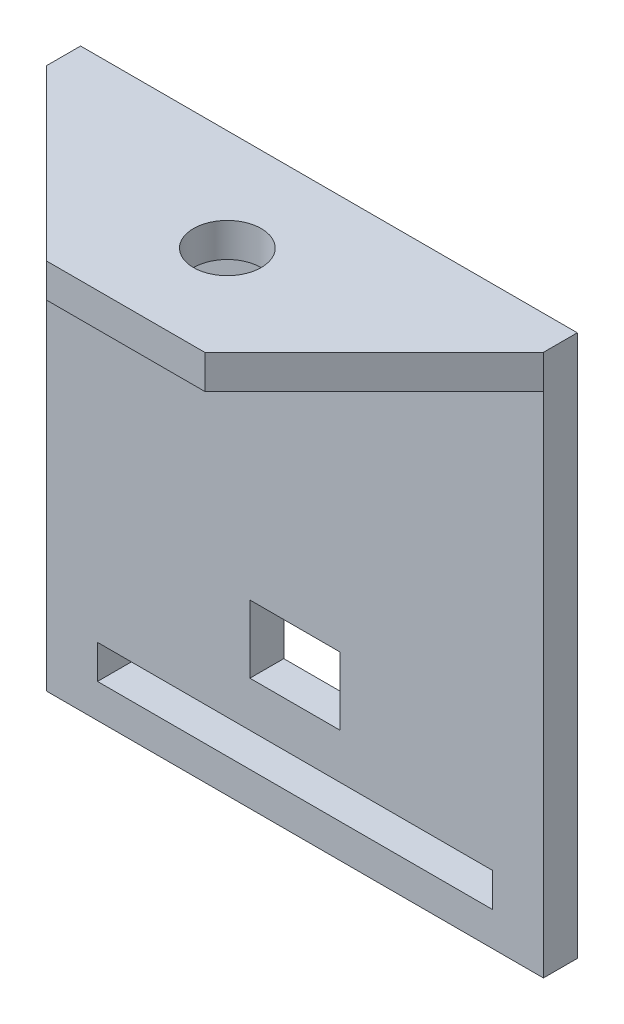
from build123d import *

# Parameters (mm, degrees)
ESTRUSIONE_ESTRUSIONE6_DEPTH = 44
SCHIZZO9_W                   = 35
SCHIZZO9_H                   = 3
TAGLIO_ESTRUSIONE2_DEPTH     = 44
SCHIZZO10_R                  = 3
TAGLIO_ESTRUSIONE3_DEPTH     = 10
SCHIZZO11_W                  = 8
SCHIZZO11_H                  = 6
TAGLIO_ESTRUSIONE4_DEPTH     = 10
SMUSSO1_SIZE                 = 15


with BuildPart() as part:
    # Schizzo8 → Estrusione-Estrusione6 (new body)
    with BuildSketch(Plane(origin=(0, 0, 0), x_dir=(0, 0, -1), z_dir=(1, 0, 0))):
        Polygon((0, 0), (0, 3), (18, 3), (18, -45), (15, -45), (15, 0), align=None)
    extrude(amount=ESTRUSIONE_ESTRUSIONE6_DEPTH)

    # Schizzo9 → Taglio-Estrusione2 (cut)
    with BuildSketch(Plane.XY.offset(-15)):
        with Locations((22, -40.5)):
            Rectangle(SCHIZZO9_W, SCHIZZO9_H)
    extrude(amount=-TAGLIO_ESTRUSIONE2_DEPTH, mode=Mode.SUBTRACT)

    # Schizzo10 → Taglio-Estrusione3 (cut)
    with BuildSketch(Plane(origin=(0, 3, 0), x_dir=(1, 0, 0), z_dir=(0, 1, 0))):
        with Locations((22, 9)):
            Circle(SCHIZZO10_R)
    extrude(amount=-TAGLIO_ESTRUSIONE3_DEPTH, mode=Mode.SUBTRACT)

    # Schizzo11 → Taglio-Estrusione4 (cut)
    with BuildSketch(Plane(origin=(0, 0, -18), x_dir=(-1, 0, 0), z_dir=(0, 0, -1))):
        with Locations((-22, -32)):
            Rectangle(SCHIZZO11_W, SCHIZZO11_H)
    extrude(amount=-TAGLIO_ESTRUSIONE4_DEPTH, mode=Mode.SUBTRACT)

    # Smusso1
    smusso1_edges = [part.edges().sort_by_distance(p)[0] for p in [
        (44, 1.5, 0),
        (0, 1.5, 0),
    ]]
    chamfer(smusso1_edges, length=SMUSSO1_SIZE)


solid = part.part
